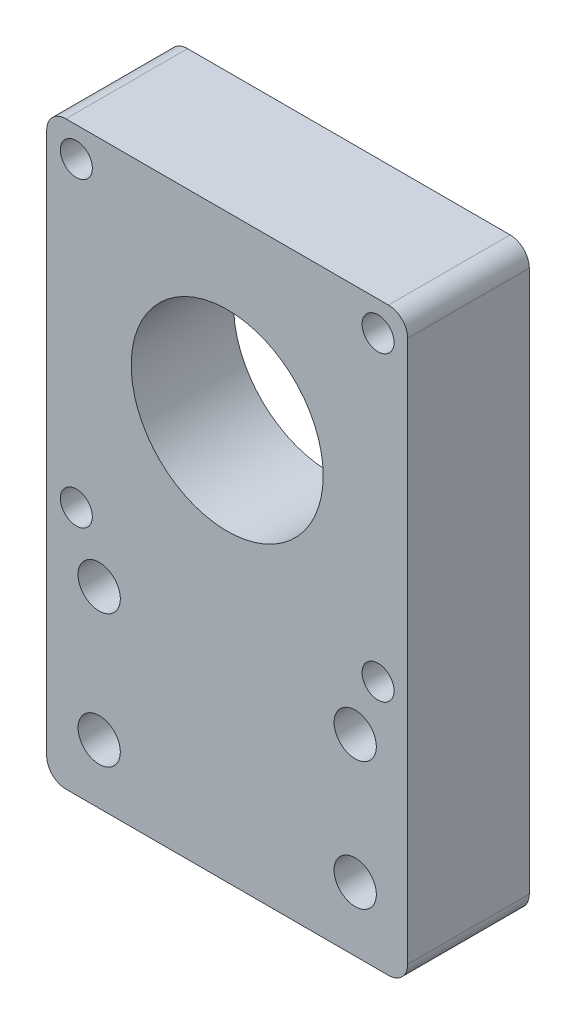
from build123d import *

# Parameters (mm, degrees)
SKETCH1_W               = 56.4
SKETCH1_H               = 56.4
BOSS_EXTRUDE1_DEPTH     = 19
SKETCH2_R               = 20.904355549
CUT_EXTRUDE2_DEPTH      = 20
SKETCH3_W               = 56.4
SKETCH3_H               = 34.3
BOSS_EXTRUDE2_DEPTH     = 19
FILLET1_R               = 3
TAP_DRILL_FOR_M6_TAP1_D = 5
M6_CLEARANCE_HOLE1_D    = 6.6
SKETCH8_R               = 20.904355549
SKETCH8_R_2             = 15
BOSS_EXTRUDE3_DEPTH     = 16


with BuildPart() as part:
    # Sketch1 → Boss-Extrude1 (new body)
    with BuildSketch(Plane.XY):
        with Locations((0, 25)):
            Rectangle(SKETCH1_W, SKETCH1_H)
    extrude(amount=BOSS_EXTRUDE1_DEPTH)

    # Sketch2 → Cut-Extrude2 (cut)
    with BuildSketch(Plane.XY.offset(19)):
        with Locations((0, 25)):
            Circle(SKETCH2_R)
    extrude(amount=-CUT_EXTRUDE2_DEPTH, mode=Mode.SUBTRACT)

    # Sketch3 → Boss-Extrude2 (add)
    with BuildSketch(Plane(origin=(0, 0, 0), x_dir=(-1, 0, 0), z_dir=(0, 0, -1))):
        with Locations((0, -20.35)):
            Rectangle(SKETCH3_W, SKETCH3_H)
    extrude(amount=-BOSS_EXTRUDE2_DEPTH)

    # Fillet1
    fillet1_edges = [part.edges().sort_by_distance(p)[0] for p in [
        (28.2, -37.5, 9.5),
        (-28.2, -37.5, 9.5),
        (28.2, 53.2, 9.5),
        (-28.2, 53.2, 9.5),
    ]]
    fillet(fillet1_edges, radius=FILLET1_R)

    # Tap Drill for M6 Tap1 (through all)
    with Locations(Plane(origin=(0, 0, 0), x_dir=(-1, 0, 0), z_dir=(0, 0, -1))):
        with Locations((-23.57, 48.57), (23.57, 48.57), (-23.57, 1.43), (23.57, 1.43)):
            Hole(TAP_DRILL_FOR_M6_TAP1_D / 2)

    # M6 Clearance Hole1 (through all)
    with Locations(Plane(origin=(0, 0, 0), x_dir=(-1, 0, 0), z_dir=(0, 0, -1))):
        with Locations((-20, -7.5), (-20, -27.5), (20, -28.237657735), (20, -7.5)):
            Hole(M6_CLEARANCE_HOLE1_D / 2)

    # Sketch8 → Boss-Extrude3 (add)
    with BuildSketch(Plane.XY.offset(19)):
        with Locations((0, 25)):
            Circle(SKETCH8_R)
        with Locations((0, 25)):
            Circle(SKETCH8_R_2, mode=Mode.SUBTRACT)
    extrude(amount=-BOSS_EXTRUDE3_DEPTH)


solid = part.part
